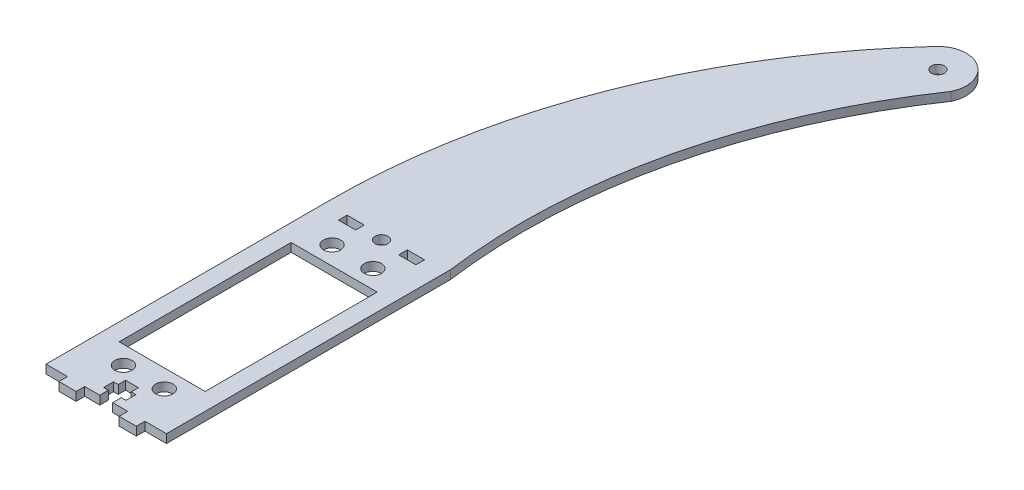
from build123d import *

# Parameters (mm, degrees)
SKETCH1_R           = 2
SKETCH1_R_2         = 1.5
SKETCH1_W           = 20
SKETCH1_H           = 40
SKETCH1_W_2         = 4
SKETCH1_H_2         = 2
BOSS_EXTRUDE1_DEPTH = 2
BOSS_EXTRUDE2_DEPTH = 2
SKETCH4_R           = 1.5
CUT_EXTRUDE1_DEPTH  = 2


with BuildPart() as part:
    # Sketch1 → Boss-Extrude1 (new body)
    with BuildSketch(Plane(origin=(0, 0, 0), x_dir=(1, 0, 0), z_dir=(0, 1, 0))):
        Polygon((0, 0), (5, 0), (5, -2), (9, -2), (9, 0), (12.5, 0), (12.5, 2), (11.4, 2), (11.4, 4.3), (12.5, 4.3), (12.5, 6), (15.5, 6), (15.5, 4.3), (16.6, 4.3), (16.6, 2), (15.5, 2), (15.5, 0), (19, 0), (19, -2), (23, -2), (23, 0), (28, 0), (28, 66), (0, 66), align=None)
        with Locations((18.75, 57.25)):
            Circle(SKETCH1_R, mode=Mode.SUBTRACT)
        with Locations((9.25, 57.25)):
            Circle(SKETCH1_R, mode=Mode.SUBTRACT)
        with Locations((18.75, 8.75)):
            Circle(SKETCH1_R, mode=Mode.SUBTRACT)
        with Locations((9.25, 8.75)):
            Circle(SKETCH1_R, mode=Mode.SUBTRACT)
        with Locations((14, 64)):
            Circle(SKETCH1_R_2, mode=Mode.SUBTRACT)
        with Locations((14, 33)):
            Rectangle(SKETCH1_W, SKETCH1_H, mode=Mode.SUBTRACT)
        with Locations((7, 64)):
            Rectangle(SKETCH1_W_2, SKETCH1_H_2, mode=Mode.SUBTRACT)
        with Locations((21, 64)):
            Rectangle(SKETCH1_W_2, SKETCH1_H_2, mode=Mode.SUBTRACT)
    extrude(amount=BOSS_EXTRUDE1_DEPTH)

    # Sketch2 → Boss-Extrude2 (add)
    with BuildSketch(Plane(origin=(0, 2, 0), x_dir=(1, 0, 0), z_dir=(0, 1, 0))):
        with BuildLine():
            Line((0, 66), (28, 66))
            ThreePointArc((28, 66), (34.819271185, 129.864214399), (70.378490249, 183.349560802))
            ThreePointArc((70.378490249, 183.349560802), (70.223472253, 188.82876401), (64.776007814, 189.43772177))
            ThreePointArc((64.776007814, 189.43772177), (17.177564343, 135.700793296), (0, 66))
        make_face()
    extrude(amount=-BOSS_EXTRUDE2_DEPTH)

    # Sketch4 → Cut-Extrude1 (cut)
    with BuildSketch(Plane(origin=(0, 2, 0), x_dir=(1, 0, 0), z_dir=(0, 1, 0))):
        with Locations((44.36627387, 163)):
            Circle(SKETCH4_R)
        with BuildLine():
            Line((49.278104547, 158.611243867), (90.336581865, 196.333434103))
            Line((90.336581865, 196.333434103), (75.550012159, 212.427781571))
            Line((75.550012159, 212.427781571), (35.469078733, 175.603702981))
            Line((35.469078733, 175.603702981), (39.454443193, 167.388756133))
            ThreePointArc((39.454443193, 167.388756133), (48.755030003, 167.911830677), (49.278104547, 158.611243867))
        make_face()
    extrude(amount=-CUT_EXTRUDE1_DEPTH, mode=Mode.SUBTRACT)


solid = part.part
